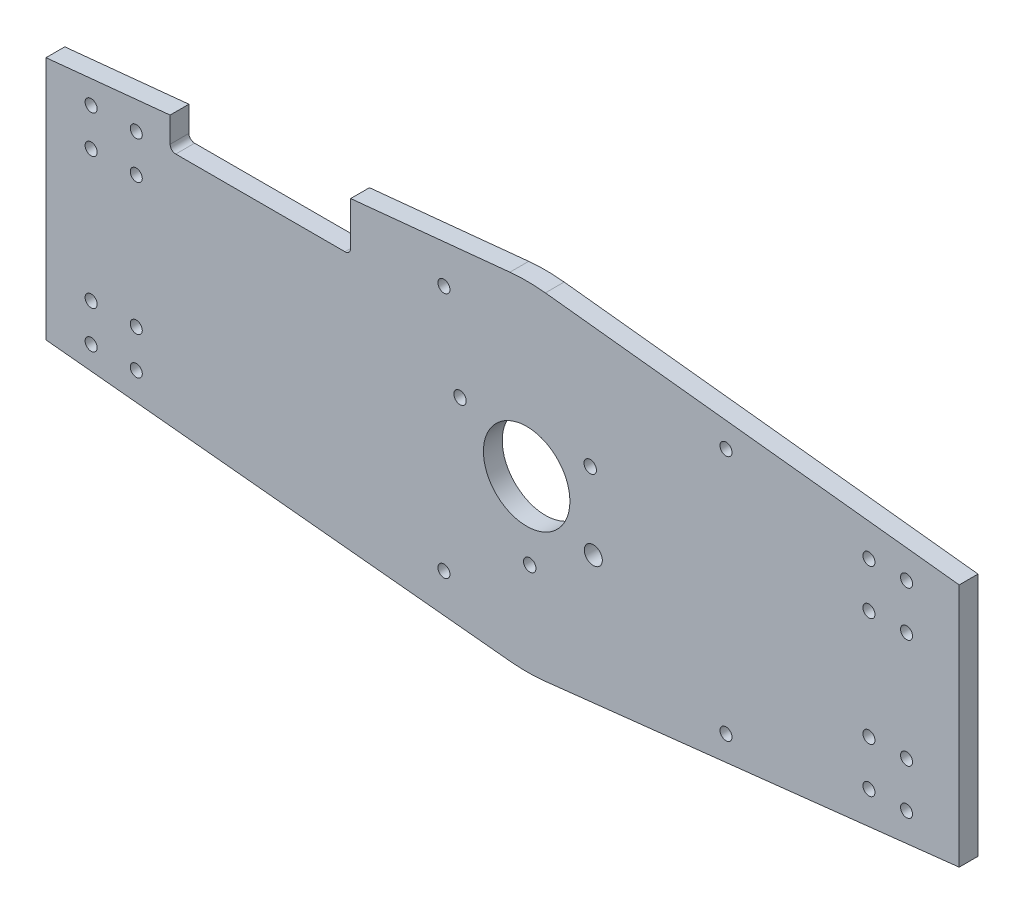
from build123d import *

# Parameters (mm, degrees)
SKETCH_1_W         = 242.801599808
SKETCH_1_H         = 80
EXTRUDE_1_DEPTH    = 5
SKETCH1_R          = 11.5
CUT_EXTRUDE1_DEPTH = 10
CUT_EXTRUDE2_DEPTH = 10
SKETCH4_R          = 30
EXTRUDE1_DEPTH     = 5
CUT_EXTRUDE3_DEPTH = 5
SKETCH6_W          = 48
SKETCH6_H          = 13
CUT_EXTRUDE4_DEPTH = 5
FILLET1_R          = 1.5
SKETCH7_R          = 1.6
CUT_EXTRUDE5_DEPTH = 10
SKETCH8_R          = 1.6
CUT_EXTRUDE6_DEPTH = 51
SKETCH9_R          = 1.6
CUT_EXTRUDE7_DEPTH = 5


with BuildPart() as part:
    # 草图1 → 凸台-拉伸1 (new body)
    with BuildSketch(Plane.XY):
        with Locations((22.457693766, 46.720773392)):
            Rectangle(SKETCH_1_W, SKETCH_1_H)
    extrude(amount=EXTRUDE_1_DEPTH)

    # Sketch1 → Cut-Extrude1 (cut)
    with BuildSketch(Plane.XY.offset(5)):
        with Locations((28.85849367, 46.720773392)):
            Circle(SKETCH1_R)
    extrude(amount=-CUT_EXTRUDE1_DEPTH, mode=Mode.SUBTRACT)

    # Sketch2 → Cut-Extrude2 (cut)
    with BuildSketch(Plane(origin=(0, 0, 0), x_dir=(-1, 0, 0), z_dir=(0, 0, -1))):
        with BuildLine():
            ThreePointArc((-47.686388409, 39.560439624), (-48.697702315, 36.320494534), (-45.457757225, 35.309180628))
            ThreePointArc((-45.457757225, 35.309180628), (-44.446443319, 38.549125718), (-47.686388409, 39.560439624))
        make_face()
        with BuildLine():
            ThreePointArc((-46.5232553, 58.879571573), (-47.21853361, 56.652109323), (-44.991071361, 55.956831013))
            ThreePointArc((-44.991071361, 55.956831013), (-44.295793051, 58.184293262), (-46.5232553, 58.879571573))
        make_face()
        with BuildLine():
            ThreePointArc((-28.907311187, 25.276011946), (-28.212032877, 27.503474195), (-30.439495126, 28.198752505))
            ThreePointArc((-30.439495126, 28.198752505), (-31.134773436, 25.971290256), (-28.907311187, 25.276011946))
        make_face()
        with BuildLine():
            ThreePointArc((-11.911006491, 57.468106938), (-12.606284802, 55.240644689), (-10.378822553, 54.545366379))
            ThreePointArc((-10.378822553, 54.545366379), (-9.683544242, 56.772828628), (-11.911006491, 57.468106938))
        make_face()
    extrude(amount=-CUT_EXTRUDE2_DEPTH, mode=Mode.SUBTRACT)

    # Sketch4 → Extrude1 (add)
    with BuildSketch(Plane.XY.offset(5)):
        with BuildLine():
            Line((-98.943106138, 79.220773392), (24.400856527, 91.499445448))
            ThreePointArc((24.400856527, 91.499445448), (29.115627781, 91.720038742), (33.827570214, 91.445579465))
            Line((33.827570214, 91.445579465), (143.85849367, 79.220773392))
            Line((143.85849367, 79.220773392), (143.85849367, 14.220773392))
            Line((143.85849367, 14.220773392), (33.827570214, 1.995967319))
            ThreePointArc((33.827570214, 1.995967319), (29.115627781, 1.721508042), (24.400856527, 1.942101336))
            Line((24.400856527, 1.942101336), (-98.943106138, 14.220773392))
            Line((-98.943106138, 14.220773392), (-98.943106138, 79.220773392))
        make_face()
        with Locations((28.85849367, 46.720773392)):
            Circle(SKETCH4_R, mode=Mode.SUBTRACT)
    extrude(amount=-EXTRUDE1_DEPTH)

    # Sketch5 → Cut-Extrude3 (cut)
    with BuildSketch(Plane.XY.offset(5)):
        with BuildLine():
            Line((-121.190655243, 16.435477327), (24.400856527, 1.942101336))
            ThreePointArc((24.400856527, 1.942101336), (29.115627781, 1.721508042), (33.827570214, 1.995967319))
            Line((33.827570214, 1.995967319), (163.346847184, 16.385995086))
            Line((163.346847184, 16.385995086), (159.4377252, -6.046504299))
            Line((159.4377252, -6.046504299), (-112.962799625, -9.05645485))
            Line((-112.962799625, -9.05645485), (-121.190655243, 16.435477327))
        make_face()
        with BuildLine():
            Line((176.736224539, 75.567946792), (33.827570214, 91.445579465))
            ThreePointArc((33.827570214, 91.445579465), (29.115627781, 91.720038742), (24.400856527, 91.499445448))
            Line((24.400856527, 91.499445448), (-131.440353805, 75.985730199))
            Line((-131.440353805, 75.985730199), (-127.706411233, 109.593555698))
            Line((-127.706411233, 109.593555698), (176.736224539, 101.182984064))
            Line((176.736224539, 101.182984064), (176.736224539, 75.567946792))
        make_face()
    extrude(amount=-CUT_EXTRUDE3_DEPTH, mode=Mode.SUBTRACT)

    # Sketch6 → Cut-Extrude4 (cut)
    with BuildSketch(Plane.XY.offset(5)):
        with Locations((-41.943106138, 80.784179294)):
            Rectangle(SKETCH6_W, SKETCH6_H)
    extrude(amount=-CUT_EXTRUDE4_DEPTH, mode=Mode.SUBTRACT)

    # Fillet1
    fillet1_edges = [part.edges().sort_by_distance(p)[0] for p in [
        (-17.943106138, 74.284179294, 2.5),
        (-65.943106138, 74.284179294, 2.5),
    ]]
    fillet(fillet1_edges, radius=FILLET1_R)

    # Sketch7 → Cut-Extrude5 (cut)
    with BuildSketch(Plane.XY.offset(5)):
        with Locations((119.85849367, 20.220773392)):
            Circle(SKETCH7_R)
        with Locations((129.85849367, 20.220773392)):
            Circle(SKETCH7_R)
        with Locations((129.85849367, 32.220773392)):
            Circle(SKETCH7_R)
        with Locations((119.85849367, 32.220773392)):
            Circle(SKETCH7_R)
        with Locations((129.85849367, 61.220773392)):
            Circle(SKETCH7_R)
        with Locations((119.85849367, 61.220773392)):
            Circle(SKETCH7_R)
        with Locations((129.85849367, 73.220773392)):
            Circle(SKETCH7_R)
        with Locations((119.85849367, 73.220773392)):
            Circle(SKETCH7_R)
    extrude(amount=-CUT_EXTRUDE5_DEPTH, mode=Mode.SUBTRACT)

    # Sketch8 → Cut-Extrude6 (cut)
    with BuildSketch(Plane.XY.offset(5)):
        with Locations((-86.943106138, 74.220773392)):
            Circle(SKETCH8_R)
        with Locations((-74.943106138, 74.220773392)):
            Circle(SKETCH8_R)
        with Locations((-74.943106138, 64.220773392)):
            Circle(SKETCH8_R)
        with Locations((-86.943106138, 64.220773392)):
            Circle(SKETCH8_R)
        with Locations((-86.943106138, 29.220773392)):
            Circle(SKETCH8_R)
        with Locations((-74.943106138, 29.220773392)):
            Circle(SKETCH8_R)
        with Locations((-86.943106138, 19.220773392)):
            Circle(SKETCH8_R)
        with Locations((-74.943106138, 19.220773392)):
            Circle(SKETCH8_R)
    extrude(amount=-CUT_EXTRUDE6_DEPTH, mode=Mode.SUBTRACT)

    # Sketch9 → Cut-Extrude7 (cut)
    with BuildSketch(Plane.XY.offset(5)):
        with Locations((6.85849367, 79.509282246)):
            Circle(SKETCH9_R)
        with Locations((81.85849367, 79.509282246)):
            Circle(SKETCH9_R)
        with Locations((6.85849367, 13.942101336)):
            Circle(SKETCH9_R)
        with Locations((81.85849367, 13.942101336)):
            Circle(SKETCH9_R)
    extrude(amount=-CUT_EXTRUDE7_DEPTH, mode=Mode.SUBTRACT)


solid = part.part
